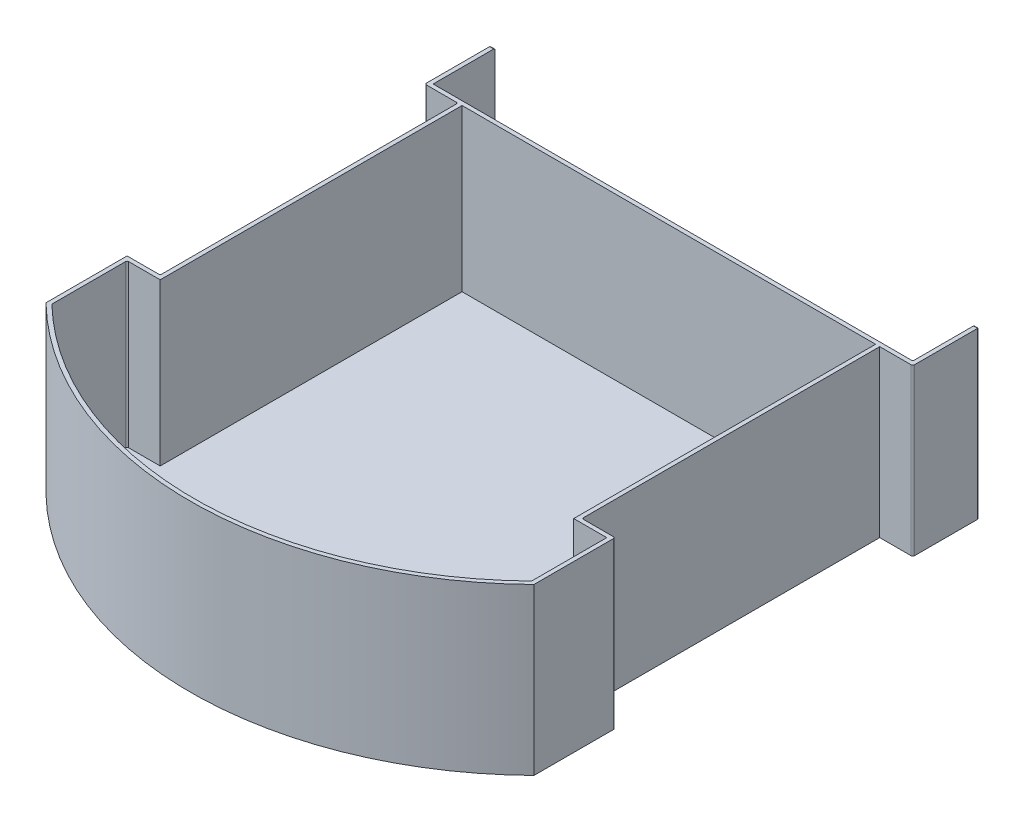
from build123d import *

# Parameters (mm, degrees)
BOSS_EXTRUDE1_DEPTH = 100
FILLET1_R           = 1
BOSS_EXTRUDE2_START = 2.5
BOSS_EXTRUDE2_DEPTH = 2.5


with BuildPart() as part:
    # Sketch1 → Boss-Extrude1 (new body)
    with BuildSketch(Plane(origin=(0, 0, 0), x_dir=(1, 0, 0), z_dir=(0, 1, 0))):
        with BuildLine():
            Line((-147.5, 118.765325103), (-145, 118.765325103))
            Line((-145, 118.765325103), (-145, 81.265325103))
            Line((-145, 81.265325103), (-125, 81.265325103))
            Line((-125, 81.265325103), (125, 81.265325103))
            Line((125, 81.265325103), (145, 81.265325103))
            Line((145, 81.265325103), (145, 118.765325103))
            Line((145, 118.765325103), (147.5, 118.765325103))
            Line((147.5, 118.765325103), (147.5, 78.765325103))
            Line((147.5, 78.765325103), (127.5, 78.765325103))
            Line((127.5, 78.765325103), (127.5, -101.234674897))
            Line((127.5, -101.234674897), (147.5, -101.234674897))
            Line((147.5, -101.234674897), (147.5, -150.264700033))
            ThreePointArc((147.5, -150.264700033), (0, -210.560514048), (-147.5, -150.264700033))
            Line((-147.5, -150.264700033), (-147.5, -101.234674897))
            Line((-147.5, -101.234674897), (-127.5, -101.234674897))
            Line((-127.5, -101.234674897), (-127.5, 78.765325103))
            Line((-127.5, 78.765325103), (-147.5, 78.765325103))
            Line((-147.5, 78.765325103), (-147.5, 118.765325103))
        make_face()
        with BuildLine():
            Line((145, -149.211854441), (145, -103.734674897))
            Line((145, -103.734674897), (125, -103.734674897))
            Line((125, -103.734674897), (125, 78.765325103))
            Line((125, 78.765325103), (-125, 78.765325103))
            Line((-125, 78.765325103), (-125, -103.734674897))
            Line((-125, -103.734674897), (-145, -103.734674897))
            Line((-145, -103.734674897), (-145, -149.211854441))
            ThreePointArc((-145, -149.211854441), (0, -208.060514048), (145, -149.211854441))
        make_face(mode=Mode.SUBTRACT)
    extrude(amount=BOSS_EXTRUDE1_DEPTH)

    # Fillet1
    fillet1_edges = [part.edges().sort_by_distance(p)[0] for p in [
        (147.5, 50, -118.765325103),
        (146.25, 100, -118.765325103),
        (145, 50, -118.765325103),
        (146.25, 0, -118.765325103),
        (-147.5, 50, 150.264700033),
        (-145, 50, 103.734674897),
        (-127.5, 50, 101.234674897),
        (-127.5, 50, -78.765325103),
        (-147.5, 50, -78.765325103),
        (-146.25, 0, -118.765325103),
        (-146.25, 100, -118.765325103),
        (127.5, 50, 101.234674897),
        (145, 50, 149.211854441),
        (147.5, 50, 101.234674897),
        (145, 50, -81.265325103),
        (147.5, 50, -78.765325103),
    ]]
    fillet(fillet1_edges, radius=FILLET1_R)

    # Sketch4 → Boss-Extrude2 (add)
    with BuildSketch(Plane(origin=(0, 0, 0), x_dir=(1, 0, 0), z_dir=(0, 1, 0)).offset(BOSS_EXTRUDE2_START)):
        with BuildLine():
            Line((147.5, 79.765325103), (147.5, 117.765325103))
            Line((147.5, 117.765325103), (145, 117.765325103))
            Line((145, 117.765325103), (145, 82.265325103))
            ThreePointArc((145, 82.265325103), (144.707106781, 81.558218322), (144, 81.265325103))
            Line((144, 81.265325103), (-145, 81.265325103))
            Line((-145, 81.265325103), (-145, 117.765325103))
            Line((-145, 117.765325103), (-147.5, 117.765325103))
            Line((-147.5, 117.765325103), (-147.5, 79.765325103))
            ThreePointArc((-147.5, 79.765325103), (-147.207106781, 79.058218322), (-146.5, 78.765325103))
            Line((-146.5, 78.765325103), (-128.5, 78.765325103))
            ThreePointArc((-128.5, 78.765325103), (-127.792893219, 78.472431884), (-127.5, 77.765325103))
            Line((-127.5, 77.765325103), (-127.5, -100.234674897))
            ThreePointArc((-127.5, -100.234674897), (-127.792893219, -100.941781678), (-128.5, -101.234674897))
            Line((-128.5, -101.234674897), (-147.5, -101.234674897))
            Line((-147.5, -101.234674897), (-147.5, -149.844449507))
            ThreePointArc((-147.5, -149.844449507), (-147.421705506, -150.232339904), (-147.19908208, -150.559490936))
            ThreePointArc((-147.19908208, -150.559490936), (0.210626014, -210.560408702), (147.5, -150.264700033))
            Line((147.5, -150.264700033), (147.5, -102.234674897))
            ThreePointArc((147.5, -102.234674897), (147.207106781, -101.527568116), (146.5, -101.234674897))
            Line((146.5, -101.234674897), (128.5, -101.234674897))
            ThreePointArc((128.5, -101.234674897), (127.792893219, -100.941781678), (127.5, -100.234674897))
            Line((127.5, -100.234674897), (127.5, 78.765325103))
            Line((127.5, 78.765325103), (146.5, 78.765325103))
            ThreePointArc((146.5, 78.765325103), (147.207106781, 79.058218322), (147.5, 79.765325103))
        make_face()
    extrude(amount=-BOSS_EXTRUDE2_DEPTH)


solid = part.part
